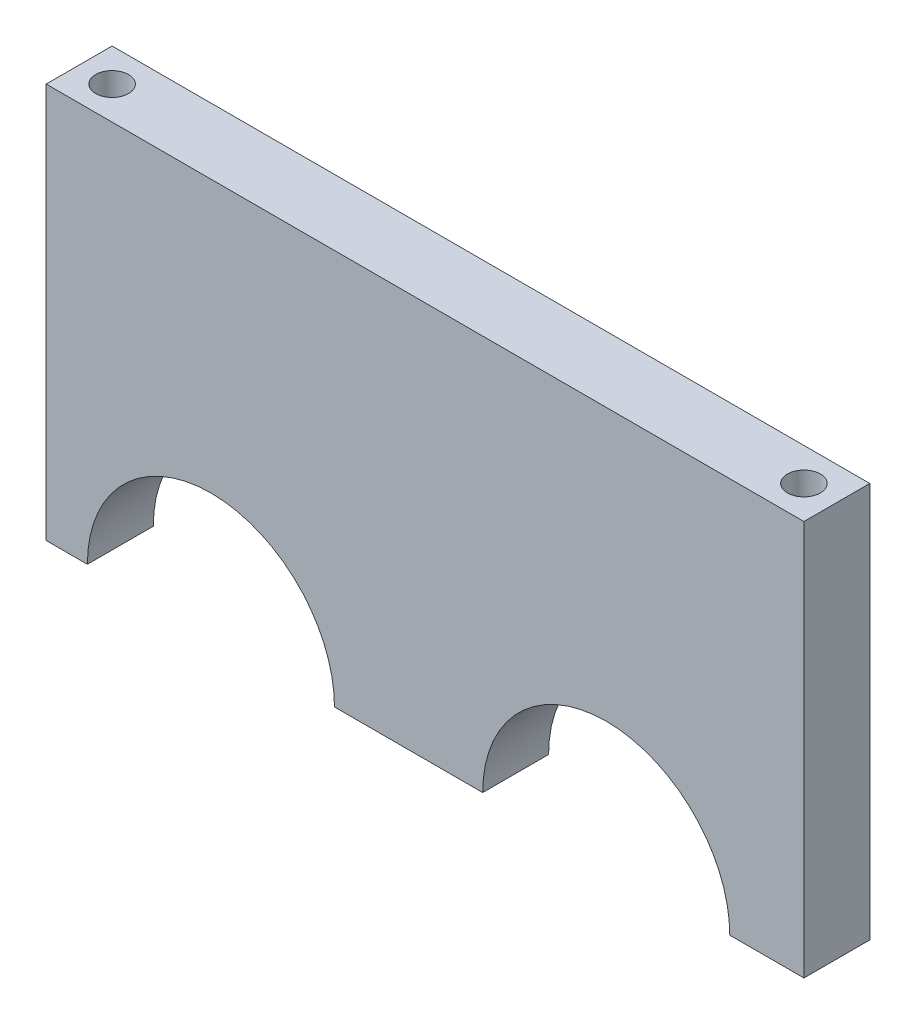
from build123d import *

# Parameters (mm, degrees)
SKETCH1_W           = 230
SKETCH1_H           = 120
BOSS_EXTRUDE1_DEPTH = 20
SKETCH2_R           = 37.5
CUT_EXTRUDE1_DEPTH  = 261.192236625
SKETCH3_R           = 5
CUT_EXTRUDE2_DEPTH  = 20


with BuildPart() as part:
    # Sketch1 → Boss-Extrude1 (new body)
    with BuildSketch(Plane.XY):
        with Locations((115, 60)):
            Rectangle(SKETCH1_W, SKETCH1_H)
    extrude(amount=BOSS_EXTRUDE1_DEPTH)

    # Sketch2 → Cut-Extrude1 (cut, through all)
    with BuildSketch(Plane.XY.offset(20)):
        with Locations((50, 0)):
            Circle(SKETCH2_R)
        with Locations((170, 0)):
            Circle(SKETCH2_R)
    extrude(amount=-CUT_EXTRUDE1_DEPTH, mode=Mode.SUBTRACT)

    # Sketch3 → Cut-Extrude2 (cut)
    with BuildSketch(Plane(origin=(0, 120, 0), x_dir=(1, 0, 0), z_dir=(0, 1, 0))):
        with Locations((220, -10)):
            Circle(SKETCH3_R)
        with Locations((10, -10)):
            Circle(SKETCH3_R)
    extrude(amount=-CUT_EXTRUDE2_DEPTH, mode=Mode.SUBTRACT)


solid = part.part
